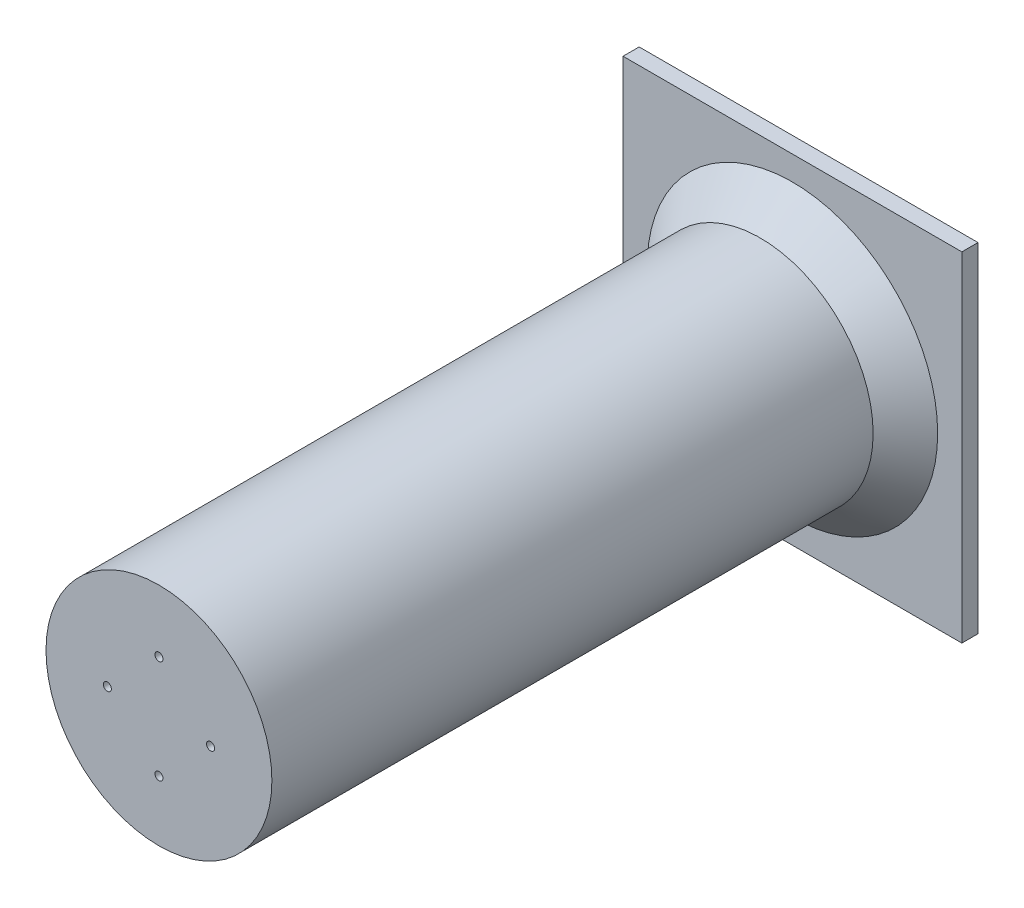
from build123d import *

# Parameters (mm, degrees)
CROQUIS1_W                  = 248.76
CROQUIS1_H                  = 195
SALIENTE_EXTRUIR1_DEPTH     = 5
CROQUIS2_W                  = 48
CROQUIS2_H                  = 30
CROQUIS2_W_2                = 30
CORTAR_EXTRUIR1_DEPTH       = 2
CROQUIS3_R                  = 2.375
CORTAR_EXTRUIR2_DEPTH       = 10
CROQUIS4_R                  = 35
SALIENTE_EXTRUIR2_DEPTH     = 196.5
CROQUIS5_R                  = 12.5
CORTAR_EXTRUIR3_DEPTH       = 10
CROQUIS12_W                 = 12
CROQUIS12_H                 = 30
SALIENTE_EXTRUIR3_DEPTH     = 4
REDONDEO1_R                 = 10
REDONDEO2_R                 = 10
REDONDEO3_R                 = 10
CORTAR_EXTRUIR5_DEPTH       = 255.266033949
CORTAR_EXTRUIR5_DEPTH_BACK  = 255.266033949
CROQUIS13_R                 = 1.625
CORTAR_EXTRUIR7_DEPTH       = 2
CROQUIS16_W                 = 105
CROQUIS16_H                 = 105
SALIENTE_EXTRUIR4_DEPTH     = 5
CHAFL_N1_SIZE               = 10
CROQUIS18_R                 = 1.625
CORTAR_EXTRUIR8_DEPTH       = 5
CORTAR_EXTRUIR13_DEPTH      = 323.659278543
CORTAR_EXTRUIR13_DEPTH_BACK = 323.659278543
CROQUIS20_W                 = 248.76
CROQUIS20_H                 = 10.372418668
CORTAR_EXTRUIR14_DEPTH      = 237.837226846
CORTAR_EXTRUIR14_DEPTH_BACK = 237.837226846
CROQUIS21_W                 = 75.005088334
CROQUIS21_H                 = 42.55455878
CROQUIS21_W_2               = 80.687232336
CROQUIS21_H_2               = 44.755283474
CORTAR_EXTRUIR15_DEPTH      = 219.307426984
CORTAR_EXTRUIR15_DEPTH_BACK = 15
CROQUIS22_R                 = 1.25


with BuildPart() as part:
    # Croquis1 → Saliente-Extruir1 (new body)
    with BuildSketch(Plane.XY):
        with Locations((7.088293187, 0.26268)):
            Rectangle(CROQUIS1_W, CROQUIS1_H)
    extrude(amount=SALIENTE_EXTRUIR1_DEPTH)

    # Croquis2 → Cortar-Extruir1 (cut)
    with BuildSketch(Plane.XY.offset(5)):
        with Locations((-93.291706813, -82.23732)):
            Rectangle(CROQUIS2_W, CROQUIS2_H)
        with Locations((116.468293187, 82.76268)):
            Rectangle(CROQUIS2_W_2, CROQUIS2_H)
        with Locations((116.468293187, -82.23732)):
            Rectangle(CROQUIS2_W_2, CROQUIS2_H)
        with Locations((-93.291706813, 82.76268)):
            Rectangle(CROQUIS2_W, CROQUIS2_H)
    extrude(amount=-CORTAR_EXTRUIR1_DEPTH, mode=Mode.SUBTRACT)

    # Croquis3 → Cortar-Extruir2 (cut)
    with BuildSketch(Plane.XY.offset(5)):
        with Locations((-93.291706813, 83.76268)):
            Circle(CROQUIS3_R)
        with Locations((-93.291706813, -83.23732)):
            Circle(CROQUIS3_R)
        with Locations((116.468293187, 83.76268)):
            Circle(CROQUIS3_R)
        with Locations((116.468293187, -83.23732)):
            Circle(CROQUIS3_R)
    extrude(amount=-CORTAR_EXTRUIR2_DEPTH, mode=Mode.SUBTRACT)

    # Croquis4 → Saliente-Extruir2 (add)
    with BuildSketch(Plane(origin=(0, 0, 0), x_dir=(-1, 0, 0), z_dir=(0, 0, -1))):
        with Locations((13.431706813, 0.26268)):
            Circle(CROQUIS4_R)
    extrude(amount=SALIENTE_EXTRUIR2_DEPTH)

    # Croquis5 → Cortar-Extruir3 (cut)
    with BuildSketch(Plane(origin=(0, 0, 0), x_dir=(-1, 0, 0), z_dir=(0, 0, -1))):
        with Locations((-76.968293187, 0.26268)):
            Circle(CROQUIS5_R)
    extrude(amount=-CORTAR_EXTRUIR3_DEPTH, mode=Mode.SUBTRACT)

    # Croquis12 → Saliente-Extruir3 (add, symmetric)
    with BuildSketch(Plane(origin=(7.088293187, 0, 0), x_dir=(0, 0, -1), z_dir=(1, 0, 0))):
        with Locations((6, 82.76268)):
            Rectangle(CROQUIS12_W, CROQUIS12_H)
        with Locations((6, -82.23732)):
            Rectangle(CROQUIS12_W, CROQUIS12_H)
    extrude(amount=SALIENTE_EXTRUIR3_DEPTH, both=True)

    # Redondeo1
    redondeo1_edges = [part.edges().sort_by_distance(p)[0] for p in [
        (7.088293187, -67.23732, 0),
        (7.088293187, 67.76268, 0),
    ]]
    fillet(redondeo1_edges, radius=REDONDEO1_R)

    # Redondeo2
    redondeo2_edges = [part.edges().sort_by_distance(p)[0] for p in [
        (7.088293187, 67.76268, -12),
        (7.088293187, -67.23732, -12),
    ]]
    fillet(redondeo2_edges, radius=REDONDEO2_R)

    # Redondeo3
    redondeo3_edges = [part.edges().sort_by_distance(p)[0] for p in [
        (7.088293187, -97.23732, -12),
        (7.088293187, 97.76268, -12),
    ]]
    fillet(redondeo3_edges, radius=REDONDEO3_R)

    # Croquis13 → Cortar-Extruir5 (cut, two sides: drawn at the far end of the back side and taken through both)
    with BuildSketch(Plane(origin=(11.088293187, 0, 0), x_dir=(0, 0, -1), z_dir=(1, 0, 0)).offset(-CORTAR_EXTRUIR5_DEPTH_BACK)):
        with Locations((6, 87.76268)):
            Circle(CROQUIS13_R)
        with Locations((6, 77.76268)):
            Circle(CROQUIS13_R)
        with Locations((6, -77.23732)):
            Circle(CROQUIS13_R)
        with Locations((6, -87.23732)):
            Circle(CROQUIS13_R)
    extrude(amount=CORTAR_EXTRUIR5_DEPTH + CORTAR_EXTRUIR5_DEPTH_BACK, mode=Mode.SUBTRACT)

    # Croquis15 → Cortar-Extruir7 (cut)
    with BuildSketch(Plane.XY.offset(5)):
        Polygon((111.468293187, 67.76268), (131.468293187, 67.76268), (131.468293187, -67.23732), (111.468293187, -67.23732), (111.468293187, -59.48732), (125.218293187, -59.48732), (125.218293187, 60.01268), (111.468293187, 60.01268), align=None)
    extrude(amount=-CORTAR_EXTRUIR7_DEPTH, mode=Mode.SUBTRACT)

    # Croquis16 → Saliente-Extruir4 (add)
    with BuildSketch(Plane(origin=(0, 0, -196.5), x_dir=(-1, 0, 0), z_dir=(0, 0, -1))):
        with Locations((13.431706813, 0.26268)):
            Rectangle(CROQUIS16_W, CROQUIS16_H)
    extrude(amount=SALIENTE_EXTRUIR4_DEPTH)

    # Chaflán1
    chafl_n1_edges = [part.edges().sort_by_distance(p)[0] for p in [
        (21.568293187, 0.26268, -196.5),
    ]]
    chamfer(chafl_n1_edges, length=CHAFL_N1_SIZE)

    # Croquis18 → Cortar-Extruir8 (cut)
    with BuildSketch(Plane.XY.offset(5)):
        with Locations((-13.431706813, 16)):
            Circle(CROQUIS18_R)
        with Locations((2.568293187, 0)):
            Circle(CROQUIS18_R)
        with Locations((-13.431706813, -16)):
            Circle(CROQUIS18_R)
        with Locations((-29.431706813, 0)):
            Circle(CROQUIS18_R)
    extrude(amount=-CORTAR_EXTRUIR8_DEPTH, mode=Mode.SUBTRACT)

    # Croquis20 → Cortar-Extruir13 (cut, two sides: drawn at the far end of the back side and taken through both)
    with BuildSketch(Plane(origin=(-65.931706813, -52.23732, -201.5), x_dir=(1, 0, 0), z_dir=(0, 1, 0)).offset(-CORTAR_EXTRUIR13_DEPTH_BACK)):
        with Locations((73.02, -206.5)):
            Rectangle(CROQUIS20_W, CROQUIS20_H)
    extrude(amount=CORTAR_EXTRUIR13_DEPTH + CORTAR_EXTRUIR13_DEPTH_BACK, mode=Mode.SUBTRACT)


with BuildPart() as cortar_extruir13_piece_1:
    # of the separate pieces the step leaves, piece 1, a body of its own (cortar_extruir13_pieces)
    add(part.part.solids().sort_by_distance((-58.431706813, 0.26268, -196.5))[0])

    # Croquis22 → Cortar-Extruir15 (cut, two sides: drawn at the far end of the back side and taken through both)
    with BuildSketch(Plane.XY.offset(-0.186209334).offset(-CORTAR_EXTRUIR15_DEPTH_BACK)):
        with Locations((-29.431706813, 0)):
            Circle(CROQUIS22_R)
        with Locations((-13.431706813, 16)):
            Circle(CROQUIS22_R)
        with Locations((2.568293187, 0)):
            Circle(CROQUIS22_R)
        with Locations((-13.431706813, -16)):
            Circle(CROQUIS22_R)
    extrude(amount=CORTAR_EXTRUIR15_DEPTH + CORTAR_EXTRUIR15_DEPTH_BACK, mode=Mode.SUBTRACT)


with BuildPart() as cortar_extruir13_piece_2:
    # of the separate pieces the step leaves, piece 2, a body of its own (cortar_extruir13_pieces)
    add(part.part.solids().sort_by_distance((11.088293187, 97.76268, -2))[0])


with BuildPart() as cortar_extruir13_piece_3:
    # of the separate pieces the step leaves, piece 3, a body of its own (cortar_extruir13_pieces)
    add(part.part.solids().sort_by_distance((11.088293187, -97.23732, -2))[0])


with BuildPart() as cortar_extruir14_tool:
    # Croquis21 → Cortar-Extruir14 (new, two sides: drawn at the far end of the back side and taken through both)
    with BuildSketch(Plane(origin=(11.088293187, 0, 0), x_dir=(0, 0, -1), z_dir=(1, 0, 0)).offset(-CORTAR_EXTRUIR14_DEPTH_BACK)):
        with Locations((37.688753501, -75.96004061)):
            Rectangle(CROQUIS21_W, CROQUIS21_H)
        with Locations((40.529825502, 75.385038263)):
            Rectangle(CROQUIS21_W_2, CROQUIS21_H_2)
    extrude(amount=CORTAR_EXTRUIR14_DEPTH + CORTAR_EXTRUIR14_DEPTH_BACK)


with BuildPart() as cortar_extruir13_piece_2_1:
    add(cortar_extruir13_piece_2.part)

    # Cortar-Extruir14: cut by cortar_extruir14_tool
    add(cortar_extruir14_tool.part, mode=Mode.SUBTRACT)


with BuildPart() as cortar_extruir13_piece_3_1:
    add(cortar_extruir13_piece_3.part)

    # Cortar-Extruir14: cut by cortar_extruir14_tool
    add(cortar_extruir14_tool.part, mode=Mode.SUBTRACT)


solid = cortar_extruir13_piece_1.part
